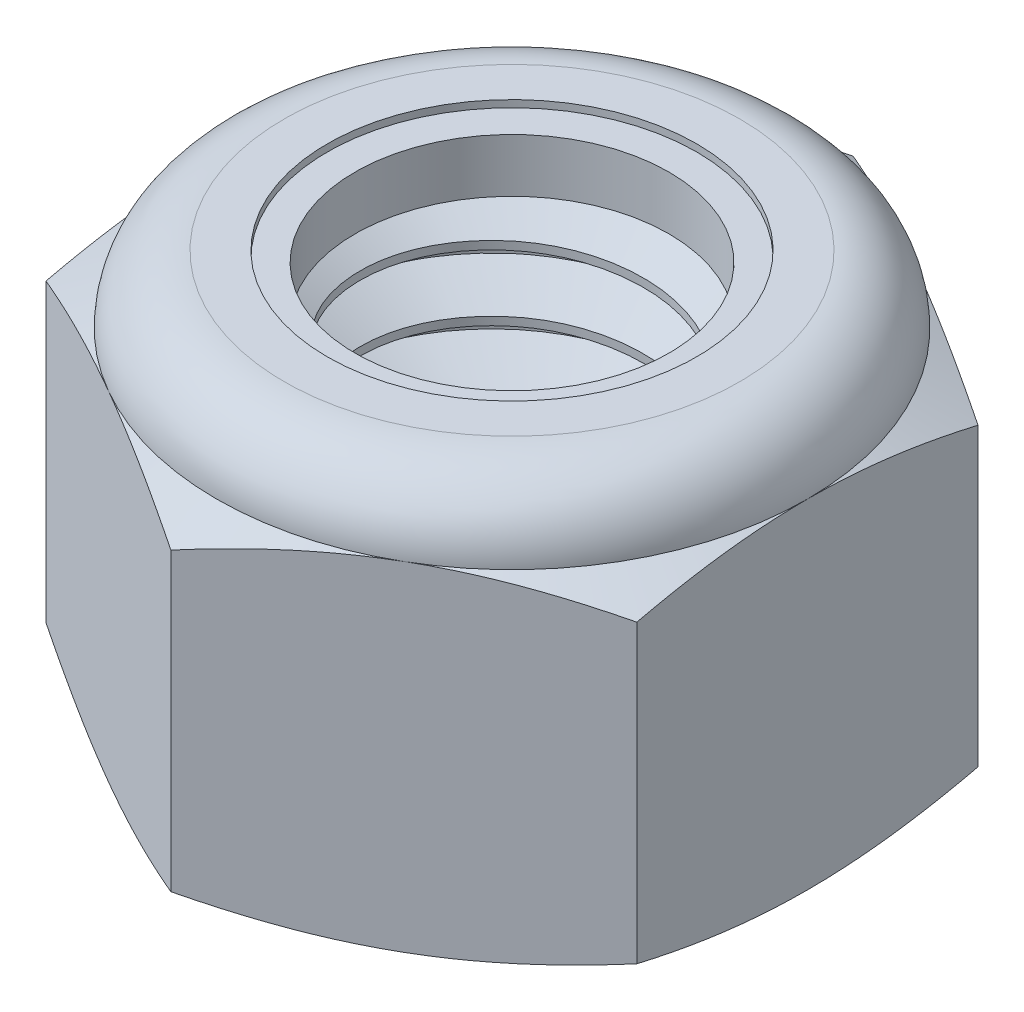
from build123d import *

# Parameters (mm, degrees)
SKETCH1_R        = 3.96875
EXTRUDE1_DEPTH   = 8.73125
SKETCH2_W        = 3.96875
SKETCH2_H        = 7.276041667
CUT_SWEEP1_PITCH = 1.411111111
SKETCH12_W       = 4.365625
SKETCH12_H       = 7.276041667


with BuildPart() as part:
    # Sketch1 → Extrude1 (new body)
    with BuildSketch(Plane(origin=(0, 0, 0), x_dir=(1, 0, 0), z_dir=(0, 1, 0))):
        Polygon((0, 7.332348419), (-6.35, 3.666174209), (-6.35, -3.666174209), (0, -7.332348419), (6.35, -3.666174209), (6.35, 3.666174209), align=None)
        with Locations(Location((0, 0, 0), (0, 0, 270))):
            Circle(SKETCH1_R, mode=Mode.SUBTRACT)
    extrude(amount=EXTRUDE1_DEPTH)

    # Sketch5 → Cut-Revolve3 (revolve, cut)
    with BuildSketch(Plane(origin=(0, 0, 0), x_dir=(0, 0, -1), z_dir=(1, 0, 0))):
        with BuildLine():
            Line((0, 0), (6.35, 0))
            Line((6.35, 0), (7.332348419, 0.458076591))
            Line((7.332348419, 0.458076591), (7.332348419, 6.817965076))
            Line((7.332348419, 6.817965076), (6.35, 7.276041667))
            ThreePointArc((6.35, 7.276041667), (5.923779347, 8.305029347), (4.894791667, 8.73125))
            Line((4.894791667, 8.73125), (4.894791667, 10.00125))
            Line((4.894791667, 10.00125), (8.602348419, 10.00125))
            Line((8.602348419, 10.00125), (8.602348419, -1.27))
            Line((8.602348419, -1.27), (0, -1.27))
            Line((0, -1.27), (0, 0))
        make_face()
    revolve(axis=Axis((0, 0, 0), (0, 1, 0)), mode=Mode.SUBTRACT)

    # Sketch6 → Cut-Revolve4 (revolve, cut)
    with BuildSketch(Plane(origin=(0, 0, 0), x_dir=(0, 0, -1), z_dir=(1, 0, 0)), mode=Mode.PRIVATE) as cut_revolve4_sk:
        with BuildLine():
            Line((0, 7.276041667), (6.1976, 7.276041667))
            ThreePointArc((6.1976, 7.276041667), (5.816016274, 8.197266274), (4.894791667, 8.57885))
            Line((4.894791667, 8.57885), (2.447395833, 8.57885))
            Line((2.447395833, 8.57885), (2.447395833, 10.00125))
            Line((2.447395833, 10.00125), (0, 10.00125))
            Line((0, 10.00125), (0, 7.276041667))
        make_face()
    revolve(cut_revolve4_sk.sketch.rotate(Axis((0, 10.00125, 0), (0, -1, 0)), 180), axis=Axis((0, 10.00125, 0), (0, -1, 0)), mode=Mode.SUBTRACT)

    # Sketch4 → Cut-Revolve2 (revolve, cut)
    with BuildSketch(Plane(origin=(0, 0, 0), x_dir=(0, 0, -1), z_dir=(1, 0, 0))):
        Polygon((0, 7.276041667), (4.365625, 7.276041667), (0, 5.240317297), align=None)
        Polygon((0, 2.03572437), (4.365625, 0), (0, 0), align=None)
    revolve(axis=Axis((0, 0, 0), (0, 1, 0)), mode=Mode.SUBTRACT)

    # Sketch12 → Revolve4 (revolve)
    with BuildSketch(Plane(origin=(0, 0, 0), x_dir=(0, 0, -1), z_dir=(1, 0, 0)), mode=Mode.PRIVATE) as revolve4_sk:
        with Locations((2.1828125, 3.638020834)):
            Rectangle(SKETCH12_W, SKETCH12_H)
    revolve(revolve4_sk.sketch.rotate(Axis((0, 0, 0), (0, 1, 0)), 350.737723233), axis=Axis((0, 0, 0), (0, 1, 0)))


with BuildPart() as body_2:
    # Sketch7 → Revolve2 (revolve)
    with BuildSketch(Plane(origin=(0, 0, 0), x_dir=(0, 0, -1), z_dir=(1, 0, 0))):
        with BuildLine():
            Line((3.3734375, 7.352241667), (6.119030844, 7.352241667))
            ThreePointArc((6.119030844, 7.352241667), (5.734762038, 8.169919611), (4.894791667, 8.50265))
            Line((4.894791667, 8.50265), (3.3734375, 8.50265))
            Line((3.3734375, 8.50265), (3.3734375, 7.352241667))
        make_face()
    revolve(axis=Axis((0, 7.352241667, 0), (0, 1, 0)))


with BuildPart() as body_3:
    # Sketch2 → Revolve1 (revolve)
    with BuildSketch(Plane(origin=(0, 0, 0), x_dir=(0, 0, -1), z_dir=(1, 0, 0))):
        with Locations((1.984375, 3.638020834)):
            Rectangle(SKETCH2_W, SKETCH2_H)
    revolve(axis=Axis((0, -3.96875, 0), (0, 1, 0)))

    # Cut-Sweep1: the profile of Sketch9 screwed along a right-hand helix of 7.1875 turns, 8 arcs to a turn; built about Z, then put on its axis
    cut_sweep1_z = Axis((0, 0, 0), (0, 0, 1))
    cut_sweep1_corners = [(4.121507259, 0, 0.088194444), (4.045128629, 0, -1.278819444), (3.052206448, 0, -0.705555556), (3.052206448, 0, -0.529166667)]
    with BuildLine(mode=Mode.PRIVATE) as cut_sweep1_profile:
        Line(cut_sweep1_corners[0], cut_sweep1_corners[1])
        Line(cut_sweep1_corners[1], cut_sweep1_corners[2])
        Line(cut_sweep1_corners[2], cut_sweep1_corners[3])
        Line(cut_sweep1_corners[3], cut_sweep1_corners[0])
    cut_sweep1_cap = Face(cut_sweep1_profile.wire())
    cut_sweep1_turn_angles = [0, 22.5, 45, 67.5, 90, 112.5, 135, 157.5, 180, 202.5, 225, 247.5, 270, 292.5, 315, 337.5, 360]
    cut_sweep1_turn_weights = [1, 0.9238795325112867, 1, 0.9238795325112867, 1, 0.9238795325112867, 1, 0.9238795325112867, 1, 0.9238795325112867, 1, 0.9238795325112867, 1, 0.9238795325112867, 1, 0.9238795325112867, 1]
    cut_sweep1_turn_rails = [Edge.make_bspline([Vector(p[0], p[1], 0).rotate(cut_sweep1_z, cut_sweep1_turn_angles[k]) / cut_sweep1_turn_weights[k] + Vector(0, 0, p[2] + CUT_SWEEP1_PITCH * cut_sweep1_turn_angles[k] / 360) for k in range(17)], [0, 0, 0, 1, 1, 2, 2, 3, 3, 4, 4, 5, 5, 6, 6, 7, 7, 8, 8, 8], 2, cut_sweep1_turn_weights) for p in cut_sweep1_corners]
    cut_sweep1_turn_sides = [Face.make_surface_from_curves(cut_sweep1_turn_rails[p[0]], cut_sweep1_turn_rails[p[1]]) for p in [(0, 1), (1, 2), (2, 3), (3, 0)]]
    cut_sweep1_last_angles = [2520, 2542.5, 2565, 2576.25, 2587.5]
    cut_sweep1_last_weights = [1, 0.9238795325112867, 1, 0.9807852804032281, 1]
    cut_sweep1_last_rails = [Edge.make_bspline([Vector(p[0], p[1], 0).rotate(cut_sweep1_z, cut_sweep1_last_angles[k]) / cut_sweep1_last_weights[k] + Vector(0, 0, p[2] + CUT_SWEEP1_PITCH * cut_sweep1_last_angles[k] / 360) for k in range(5)], [0, 0, 0, 1, 1, 2, 2, 2], 2, cut_sweep1_last_weights) for p in cut_sweep1_corners]
    cut_sweep1_last_sides = [Face.make_surface_from_curves(cut_sweep1_last_rails[p[0]], cut_sweep1_last_rails[p[1]]) for p in [(0, 1), (1, 2), (2, 3), (3, 0)]]
    cut_sweep1 = Plane(origin=(0, 7.276041667, 0), x_dir=(0, 0, -1), z_dir=(0, -1, 0)) * Solid(Shell([*[p.moved(Location((0, 0, CUT_SWEEP1_PITCH * i))) for i in range(7) for p in cut_sweep1_turn_sides], *cut_sweep1_last_sides, cut_sweep1_cap, cut_sweep1_cap.rotate(cut_sweep1_z, 2587.5).moved(Location((0, 0, CUT_SWEEP1_PITCH * 2587.5 / 360)))]))
    add(cut_sweep1, mode=Mode.SUBTRACT)

    # Sketch11 → Revolve3 (revolve)
    with BuildSketch(Plane(origin=(0, 0, 0), x_dir=(0, 0, -1), z_dir=(1, 0, 0))):
        Polygon((0, 0), (4.365625, 0), (0, 2.03572437), align=None)
    revolve(axis=Axis((0, 8.73125, 0), (0, -1, 0)))


with BuildPart() as part_1:
    add(part.part)

    # Combine1: cut body 3
    add(body_3.part, mode=Mode.SUBTRACT)


solid = Compound([body_2.part, part_1.part])
